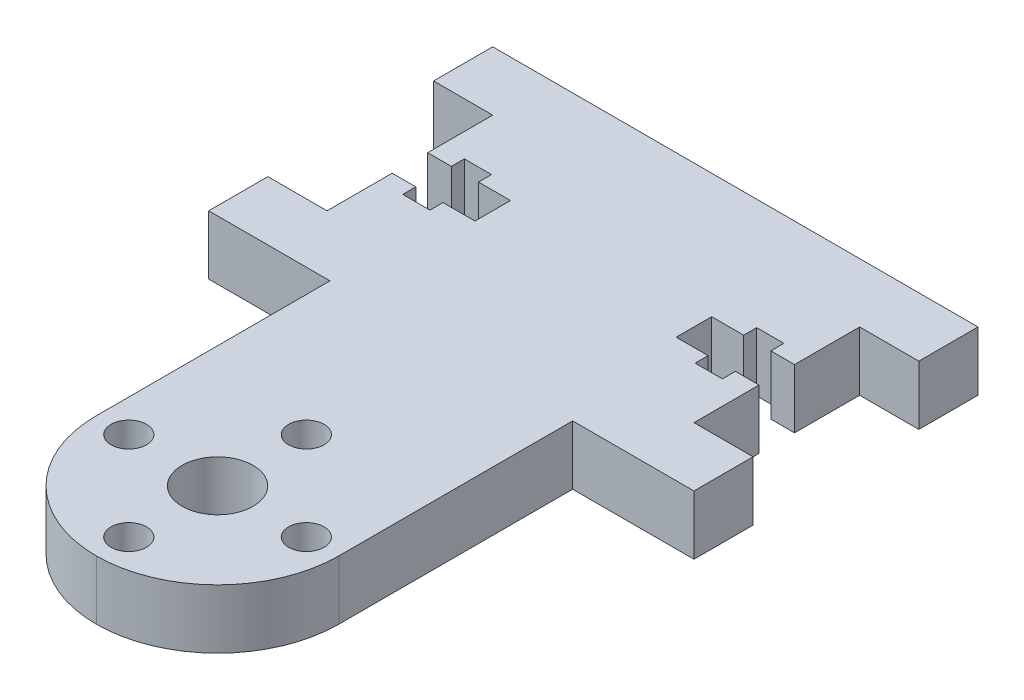
from build123d import *

# Parameters (mm, degrees)
BOSS_EXTRUDE1_DEPTH = 5
SKETCH2_W           = 20.5
SKETCH2_H           = 30
SKETCH2_R           = 3
SKETCH2_R_2         = 1.5
BOSS_EXTRUDE2_DEPTH = 5
FILLET1_R           = 10.25


with BuildPart() as part:
    # Sketch1 → Boss-Extrude1 (new body)
    with BuildSketch(Plane(origin=(0, 0, 0), x_dir=(1, 0, 0), z_dir=(0, 1, 0))):
        Polygon((44.375484097, 7.788988346), (75.375484097, 7.788988346), (80.375484097, 7.788988346), (80.375484097, 12.788988346), (75.375484097, 12.788988346), (75.375484097, 18.288988346), (73.375484097, 18.288988346), (73.375484097, 17.188988346), (71.075484097, 17.188988346), (71.075484097, 18.288988346), (68.375484097, 18.288988346), (68.375484097, 21.288988346), (71.075484097, 21.288988346), (71.075484097, 22.388988346), (73.375484097, 22.388988346), (73.375484097, 21.288988346), (75.375484097, 21.288988346), (75.375484097, 26.788988346), (80.375484097, 26.788988346), (80.375484097, 31.788988346), (75.375484097, 31.788988346), (44.375484097, 31.788988346), (39.375484097, 31.788988346), (39.375484097, 26.788988346), (44.375484097, 26.788988346), (44.375484097, 21.288988346), (46.375484097, 21.288988346), (46.375484097, 22.388988346), (48.675484097, 22.388988346), (48.675484097, 21.288988346), (51.375484097, 21.288988346), (51.375484097, 18.288988346), (48.675484097, 18.288988346), (48.675484097, 17.188988346), (46.375484097, 17.188988346), (46.375484097, 18.288988346), (44.375484097, 18.288988346), (44.375484097, 12.788988346), (39.375484097, 12.788988346), (39.375484097, 7.788988346), align=None)
    extrude(amount=BOSS_EXTRUDE1_DEPTH)

    # Sketch2 → Boss-Extrude2 (add)
    with BuildSketch(Plane(origin=(0, 5, 0), x_dir=(1, 0, 0), z_dir=(0, 1, 0))):
        with Locations((59.875484097, -7.211011654)):
            Rectangle(SKETCH2_W, SKETCH2_H)
        with Locations(Location((59.875484097, -11.961011654, 0), (0, 0, 270))):
            Circle(SKETCH2_R, mode=Mode.SUBTRACT)
        with Locations(Location((59.875484097, -19.461011654, 0), (0, 0, 270))):
            Circle(SKETCH2_R_2, mode=Mode.SUBTRACT)
        with Locations(Location((52.375484097, -11.961011654, 0), (0, 0, 90))):
            Circle(SKETCH2_R_2, mode=Mode.SUBTRACT)
        with Locations(Location((67.375484097, -11.961011654, 0), (0, 0, 90))):
            Circle(SKETCH2_R_2, mode=Mode.SUBTRACT)
        with Locations(Location((59.875484097, -4.461011654, 0), (0, 0, 270))):
            Circle(SKETCH2_R_2, mode=Mode.SUBTRACT)
    extrude(amount=-BOSS_EXTRUDE2_DEPTH)

    # Fillet1
    fillet1_edges = [part.edges().sort_by_distance(p)[0] for p in [
        (49.625484097, 2.5, 22.211011654),
        (70.125484097, 2.5, 22.211011654),
    ]]
    fillet(fillet1_edges, radius=FILLET1_R - 0.0001)  # a hair under: the kernel refuses the full size


solid = part.part
